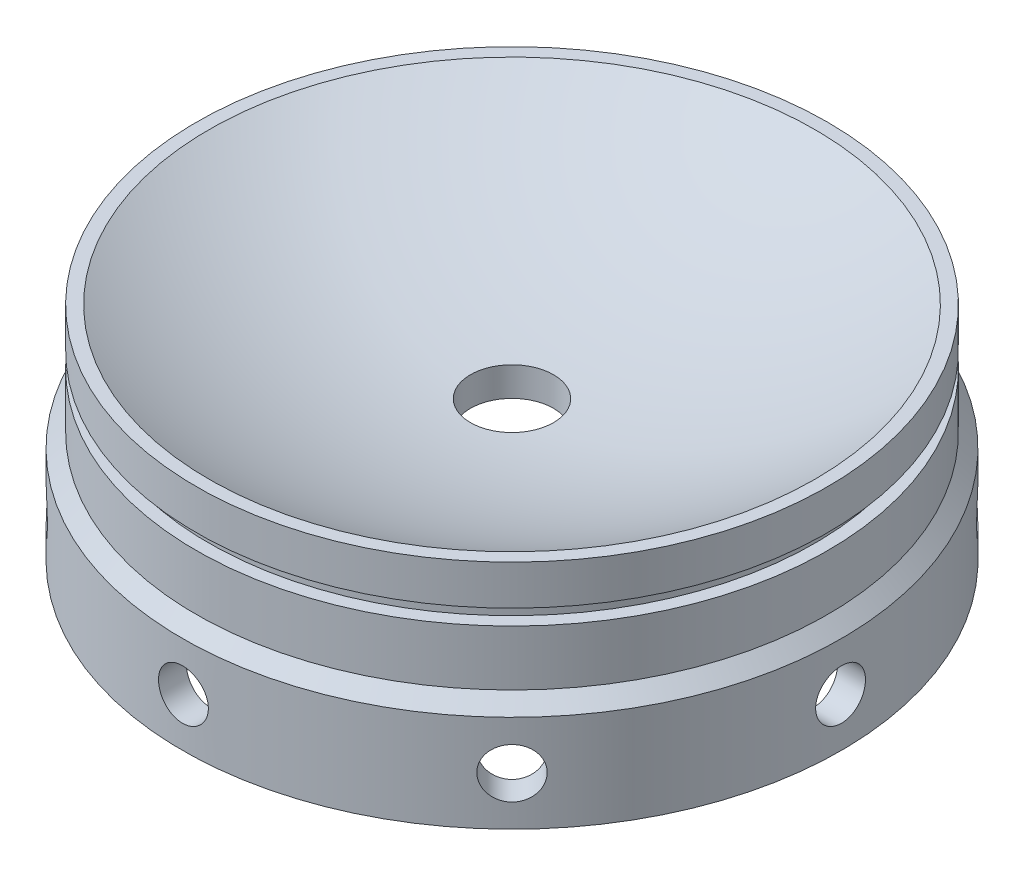
from build123d import *

# Parameters (mm, degrees)
CIRPATTERN1_COUNT = 8


with BuildPart() as part:
    # Sketch1 → Revolve1 (revolve)
    with BuildSketch(Plane.XY):
        with BuildLine():
            Line((9.525, 6.683492719), (9.525, 0))
            Line((9.525, 0), (66.04, 0))
            Line((66.04, 0), (69.215, -3.175))
            Line((69.215, -3.175), (69.215, -25.4))
            Line((69.215, -25.4), (75.565, -25.4))
            Line((75.565, -25.4), (75.565, -3.175))
            Line((75.565, -3.175), (72.39, 0))
            Line((72.39, 0), (72.39, 12.7))
            Line((72.39, 12.7), (69.469, 12.7))
            Line((69.469, 12.7), (69.469, 16.256))
            Line((69.469, 16.256), (72.39, 16.256))
            Line((72.39, 16.256), (72.39, 25.4))
            Line((72.39, 25.4), (69.469, 25.4))
            ThreePointArc((69.469, 25.4), (40.590515151, 12.53950787), (9.525, 6.683492719))
        make_face()
    revolve(axis=Axis((0, 0, 0), (0, 1, 0)))

    # Sketch8 → 1/2 (0.45) Diameter Hole1 (revolve, cut)
    with BuildSketch(Plane(origin=(75.565, -14.2875, 0), x_dir=(0, 0, -1), z_dir=(0, 1, 0))):
        Polygon((0, 0), (0, 78.997918438), (5.715, 75.564), (5.715, 0), align=None)
    f_1_2_0_45_diameter_hole1 = revolve(axis=Axis((81.915, -14.2875, 0), (-1, 0, 0)), mode=Mode.SUBTRACT)

    # CirPattern1: 1/2 (0.45) Diameter Hole1 ×8 about axis
    cirpattern1_axis = Axis((0, -25.4, 0), (0, -1, 0))
    for i in range(1, CIRPATTERN1_COUNT):
        add(f_1_2_0_45_diameter_hole1.rotate(cirpattern1_axis, i * 360 / CIRPATTERN1_COUNT), mode=Mode.SUBTRACT)


solid = part.part
